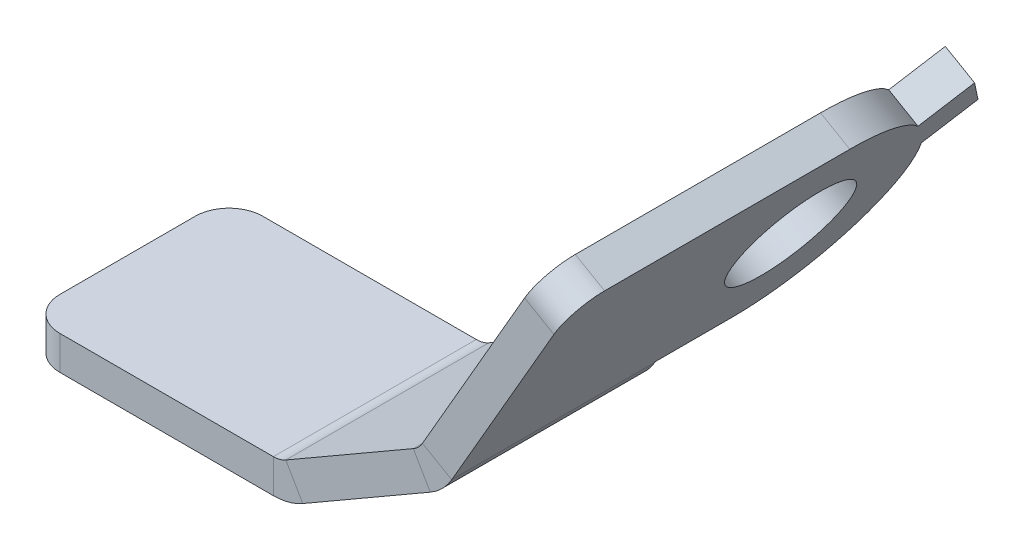
from build123d import *

# Parameters (mm, degrees)
SKETCH1_R                  = 1.75
BOSS_EXTRUDE1_DEPTH        = 1
BOSS_EXTRUDE2_START        = -1
BOSS_EXTRUDE2_DEPTH        = 1
SKETCHED_START             = 7.177417197
SKETCHED_BEND1_OUTLINE_R   = 1.75
SKETCHED_BEND1_DEPTH       = 1.366025404
SKETCHED_START_2           = -14
SKETCHED_BEND1_2_DEPTH     = 14
SKETCHED_START_3           = -6
SKETCHED_BEND1_3_DEPTH     = 5
SKETCHED_START_4           = -1.253227831
SKETCHED_BEND1_4_DEPTH     = 1.253227831
SKETCHED_START_5           = -6.500618506
SKETCHED_BEND1_5_DEPTH     = 0.500618506
SKETCHED_START_6           = -0.400872669
SKETCHED_BEND1_6_OUTLINE_R = 1.75
SKETCHED_BEND1_6_DEPTH     = 1


with BuildPart() as part:
    # Sketch1 → Boss-Extrude1 (new body)
    with BuildSketch(Plane(origin=(0, 0, 0), x_dir=(1, 0, 0), z_dir=(0, 1, 0))):
        with BuildLine():
            Line((-9.134882229, 6), (2.865117771, 6))
            Line((2.865117771, 6), (2.865117771, 8.250618606))
            ThreePointArc((2.865117771, 8.250618606), (6.365117771, 11.750618606), (9.865117771, 8.250618606))
            Line((9.865117771, 8.250618606), (9.865117771, 6))
            Line((9.865117771, 6), (9.865117771, 1))
            ThreePointArc((9.865117771, 1), (9.572224552, 0.292893219), (8.865117771, 0))
            Line((8.865117771, 0), (-9.134882229, 0))
            ThreePointArc((-9.134882229, 0), (-9.84198901, 0.292893219), (-10.134882229, 1))
            Line((-10.134882229, 1), (-10.134882229, 5))
            ThreePointArc((-10.134882229, 5), (-9.84198901, 5.707106781), (-9.134882229, 6))
        make_face()
        with Locations(Location((6.365117771, 8.250618606, 0), (0, 0, 270))):
            Circle(SKETCH1_R, mode=Mode.SUBTRACT)
    extrude(amount=BOSS_EXTRUDE1_DEPTH)

    # Sketch3 → Boss-Extrude2 (add)
    with BuildSketch(Plane(origin=(0, 1, 0), x_dir=(1, 0, 0), z_dir=(0, 1, 0)).offset(BOSS_EXTRUDE2_START)):
        with BuildLine():
            Line((8.17494801, 12.885336532), (7.42494801, 11.586298426))
            ThreePointArc((7.42494801, 11.586298426), (8.115117771, 11.281707519), (8.723986115, 10.836298426))
            Line((8.723986115, 10.836298426), (9.473986115, 12.135336532))
            Line((9.473986115, 12.135336532), (8.17494801, 12.885336532))
        make_face()
    extrude(amount=BOSS_EXTRUDE2_DEPTH)

    # Sketched Bend1: read off the stored shape, not the designer's step
    # Sketched Bend1 outline → Sketched Bend1 (cut)
    with BuildSketch(Plane(origin=(0, 0, 0), x_dir=(0.49999999999999767, 0.86602540378444, 0), z_dir=(0.8660254037844399, -0.49999999999999795, 0)).offset(SKETCHED_START)):
        with Locations((7.402836748, -8.250618606)):
            Circle(SKETCHED_BEND1_OUTLINE_R)
    extrude(amount=SKETCHED_BEND1_DEPTH, mode=Mode.SUBTRACT)

    # Sketched Bend1 2 outline → Sketched Bend1 2 (cut)
    with BuildSketch(Plane.XY.offset(SKETCHED_START_2)):
        with BuildLine():
            Line((-0.626369748, 1), (-1.955441123, 0.232660284))
            ThreePointArc((-1.955441123, 0.232660284), (-2.374275969, 0.05917321), (-2.823741123, 0))
            Line((-2.823741123, 0), (9.865117771, 0))
            Line((9.865117771, 0), (9.865117771, 1))
            Line((9.865117771, 1), (-0.626369748, 1))
        make_face()
    extrude(amount=SKETCHED_BEND1_2_DEPTH, mode=Mode.SUBTRACT)

    # Sketched Bend1 3 outline → Sketched Bend1 3 (add)
    with BuildSketch(Plane.XY.offset(SKETCHED_START_3)):
        with BuildLine():
            ThreePointArc((1.583564135, 3.544558877), (1.466504678, 3.392004022), (1.313949823, 3.274944565))
            Line((1.313949823, 3.274944565), (-2.455441123, 1.098685688))
            ThreePointArc((-2.455441123, 1.098685688), (-2.633095014, 1.025099036), (-2.823741123, 1))
            Line((-2.823741123, 1), (-0.626369748, 1))
            Line((-0.626369748, 1), (1.813949823, 2.408919161))
            ThreePointArc((1.813949823, 2.408919161), (2.173611459, 2.684897241), (2.449589539, 3.044558877))
            Line((2.449589539, 3.044558877), (5.970277863, 9.142569932))
            Line((5.970277863, 9.142569932), (5.104252459, 9.642569932))
            Line((5.104252459, 9.642569932), (1.583564135, 3.544558877))
        make_face()
    extrude(amount=SKETCHED_BEND1_3_DEPTH)

    # Sketched Bend1 4 outline → Sketched Bend1 4 (add)
    with BuildSketch(Plane.XY.offset(SKETCHED_START_4)):
        with BuildLine():
            ThreePointArc((1.583564135, 3.544558877), (1.466504678, 3.392004022), (1.313949823, 3.274944565))
            Line((1.313949823, 3.274944565), (-2.455441123, 1.098685688))
            ThreePointArc((-2.455441123, 1.098685688), (-2.633095014, 1.025099036), (-2.823741123, 1))
            Line((-2.823741123, 1), (-0.626369748, 1))
            Line((-0.626369748, 1), (1.813949823, 2.408919161))
            ThreePointArc((1.813949823, 2.408919161), (2.173611459, 2.684897241), (2.449589539, 3.044558877))
            Line((2.449589539, 3.044558877), (2.470277863, 3.080392105))
            Line((2.470277863, 3.080392105), (1.604252459, 3.580392105))
            Line((1.604252459, 3.580392105), (1.583564135, 3.544558877))
        make_face()
    extrude(amount=SKETCHED_BEND1_4_DEPTH)

    # Sketched Bend1 5 outline → Sketched Bend1 5 (add)
    with BuildSketch(Plane.XY.offset(SKETCHED_START_5)):
        Polygon((5.104252459, 9.642569932), (1.604252459, 3.580392105), (2.470277863, 3.080392105), (5.970277863, 9.142569932), align=None)
    extrude(amount=SKETCHED_BEND1_5_DEPTH)

    # Sketched Bend1 6 outline → Sketched Bend1 6 (add)
    with BuildSketch(Plane(origin=(0, 0, 0), x_dir=(0.49999999999999767, 0.86602540378444, 0), z_dir=(0.8660254037844399, -0.49999999999999795, 0)).offset(SKETCHED_START_6)):
        with BuildLine():
            Line((3.8614601, 0), (3.8614601, -6))
            Line((3.8614601, -6), (3.902836748, -6))
            Line((3.902836748, -6), (3.902836748, -8.250618606))
            ThreePointArc((3.902836748, -8.250618606), (5.336367033, -11.075455401), (8.462666987, -11.586298426))
            Line((8.462666987, -11.586298426), (9.212666987, -12.885336532))
            Line((9.212666987, -12.885336532), (10.511705093, -12.135336532))
            Line((10.511705093, -12.135336532), (9.761705093, -10.836298426))
            ThreePointArc((9.761705093, -10.836298426), (10.604870415, -9.663764174), (10.902836748, -8.250618606))
            Line((10.902836748, -8.250618606), (10.902836748, -1))
            ThreePointArc((10.902836748, -1), (10.609943529, -0.292893219), (9.902836748, 0))
            Line((9.902836748, 0), (3.8614601, 0))
        make_face()
        with Locations((7.402836748, -8.250618606)):
            Circle(SKETCHED_BEND1_6_OUTLINE_R, mode=Mode.SUBTRACT)
    extrude(amount=SKETCHED_BEND1_6_DEPTH)


solid = part.part
